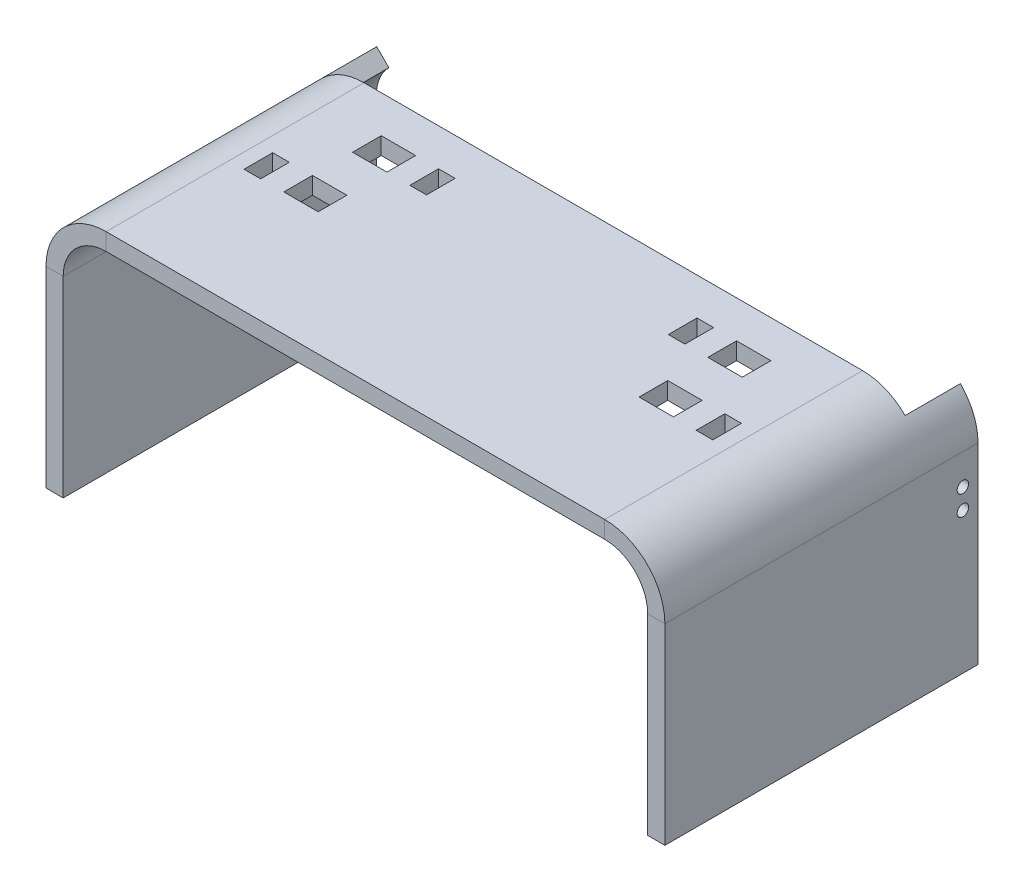
from build123d import *

# Parameters (mm, degrees)
SKETCH1_W               = 2.9
SKETCH1_H               = 5
SKETCH1_W_2             = 6
BASE_FLANGE1_DEPTH      = 3
SKETCHED_START          = -41.587720567
SKETCHED_BEND1_DEPTH    = 54.641148945
SKETCHED_BEND1_2_DEPTH  = 9.641148945
SKETCHED_BEND1_3_DEPTH  = 54.641148945
SKETCHED_START_2        = -31.946571622
SKETCHED_BEND1_4_DEPTH  = 45
CUT_EXTRUDE2_DEPTH      = 122.204531689
CUT_EXTRUDE2_DEPTH_BACK = 122.204531689
SKETCH32_R              = 1


# Read off the part's stored shape, not the designer's step: Sketched Bend1
# Sheet-metal steps are written as plain solids
with BuildPart() as part:
    # Sketch1 → Base-Flange1 (new body)
    with BuildSketch(Plane(origin=(0, 0, 0), x_dir=(1, 0, 0), z_dir=(0, 1, 0))):
        Polygon((-80, 31.946571622), (-80, -13.053428378), (80, -13.053428378), (80, 31.946571622), (80, 41.587720567), (45, 41.587720567), (45, 31.946571622), (-45, 31.946571622), (-45, 41.587720567), (-80, 41.587720567), align=None)
        with Locations((-39.45, 10.905641405)):
            Rectangle(SKETCH1_W, SKETCH1_H, mode=Mode.SUBTRACT)
        with Locations((-22.55, 22.947848405)):
            Rectangle(SKETCH1_W, SKETCH1_H, mode=Mode.SUBTRACT)
        with Locations((-31, 22.946571622)):
            Rectangle(SKETCH1_W_2, SKETCH1_H, mode=Mode.SUBTRACT)
        with Locations((-31, 10.946571622)):
            Rectangle(SKETCH1_W_2, SKETCH1_H, mode=Mode.SUBTRACT)
        with Locations((31, 10.946571622)):
            Rectangle(SKETCH1_W_2, SKETCH1_H, mode=Mode.SUBTRACT)
        with Locations((31, 22.946571622)):
            Rectangle(SKETCH1_W_2, SKETCH1_H, mode=Mode.SUBTRACT)
        with Locations((22.55, 22.947848405)):
            Rectangle(SKETCH1_W, SKETCH1_H, mode=Mode.SUBTRACT)
        with Locations((39.45, 10.905641405)):
            Rectangle(SKETCH1_W, SKETCH1_H, mode=Mode.SUBTRACT)
    extrude(amount=-BASE_FLANGE1_DEPTH)

    # Sketched Bend1 outline → Sketched Bend1 (cut)
    with BuildSketch(Plane.XY.offset(SKETCHED_START)):
        with BuildLine():
            Line((50.848469227, -3), (80, -3))
            Line((80, -3), (80, 0))
            Line((80, 0), (43.5, 0))
            ThreePointArc((43.5, 0), (47.468626966, -0.778888953), (50.848469227, -3))
        make_face()
        with BuildLine():
            Line((-43.5, 0), (-80, 0))
            Line((-80, 0), (-80, -3))
            Line((-80, -3), (-50.848469227, -3))
            ThreePointArc((-50.848469227, -3), (-47.468626966, -0.778888953), (-43.5, 0))
        make_face()
    extrude(amount=SKETCHED_BEND1_DEPTH, mode=Mode.SUBTRACT)

    # Sketched Bend1 2 outline → Sketched Bend1 2 (cut)
    with BuildSketch(Plane.XY.offset(SKETCHED_START)):
        with BuildLine():
            Line((45, -3), (50.848469227, -3))
            ThreePointArc((50.848469227, -3), (48.154590073, -1.088050614), (45, -0.107695155))
            Line((45, -0.107695155), (45, -3))
        make_face()
        with BuildLine():
            Line((-50.848469227, -3), (-45, -3))
            Line((-45, -3), (-45, -0.107695155))
            ThreePointArc((-45, -0.107695155), (-48.154590073, -1.088050614), (-50.848469227, -3))
        make_face()
    extrude(amount=SKETCHED_BEND1_2_DEPTH, mode=Mode.SUBTRACT)



with BuildPart() as body_2:
    # Sketched Bend1 3 outline → Sketched Bend1 3 (new body)
    with BuildSketch(Plane.XY.offset(SKETCHED_START)):
        with BuildLine():
            Line((50.924621202, -3.075378798), (48.803300859, -5.196699141))
            ThreePointArc((48.803300859, -5.196699141), (50.429096494, -7.629874257), (51, -10.5))
            Line((51, -10.5), (51, -44))
            Line((51, -44), (54, -44))
            Line((54, -44), (54, -10.5))
            ThreePointArc((54, -10.5), (53.200735091, -6.48182396), (50.924621202, -3.075378798))
        make_face()
        with BuildLine():
            ThreePointArc((-51, -10.5), (-50.429096494, -7.629874257), (-48.803300859, -5.196699141))
            Line((-48.803300859, -5.196699141), (-50.924621202, -3.075378798))
            ThreePointArc((-50.924621202, -3.075378798), (-53.200735091, -6.48182396), (-54, -10.5))
            Line((-54, -10.5), (-54, -44))
            Line((-54, -44), (-51, -44))
            Line((-51, -44), (-51, -10.5))
        make_face()
    extrude(amount=SKETCHED_BEND1_3_DEPTH)


with BuildPart() as part_1:
    add(part.part)

    add(body_2.part)  # Sketched Bend1 4 merges body 2
    # Sketched Bend1 4 outline → Sketched Bend1 4 (add)
    with BuildSketch(Plane.XY.offset(SKETCHED_START_2)):
        with BuildLine():
            ThreePointArc((43.5, -3), (46.370125743, -3.570903506), (48.803300859, -5.196699141))
            Line((48.803300859, -5.196699141), (50.924621202, -3.075378798))
            ThreePointArc((50.924621202, -3.075378798), (50.886641368, -3.037592259), (50.848469227, -3))
            Line((50.848469227, -3), (43.5, -3))
        make_face()
        with BuildLine():
            ThreePointArc((-48.803300859, -5.196699141), (-46.370125743, -3.570903506), (-43.5, -3))
            Line((-43.5, -3), (-50.848469227, -3))
            ThreePointArc((-50.848469227, -3), (-50.886641368, -3.037592259), (-50.924621202, -3.075378798))
            Line((-50.924621202, -3.075378798), (-48.803300859, -5.196699141))
        make_face()
    extrude(amount=SKETCHED_BEND1_4_DEPTH)

    # Sketch32 → Cut-Extrude2 (cut, two sides: drawn at the far end of the back side and taken through both)
    with BuildSketch(Plane.ZY.offset(-51).offset(-CUT_EXTRUDE2_DEPTH_BACK)):
        with Locations(Location((-38.946571622, -19.363015099, 0), (0, 0, 270))):
            Circle(SKETCH32_R)
        with Locations(Location((-38.946571622, -15.85, 0), (0, 0, 270))):
            Circle(SKETCH32_R)
    extrude(amount=CUT_EXTRUDE2_DEPTH + CUT_EXTRUDE2_DEPTH_BACK, mode=Mode.SUBTRACT)


solid = part_1.part
